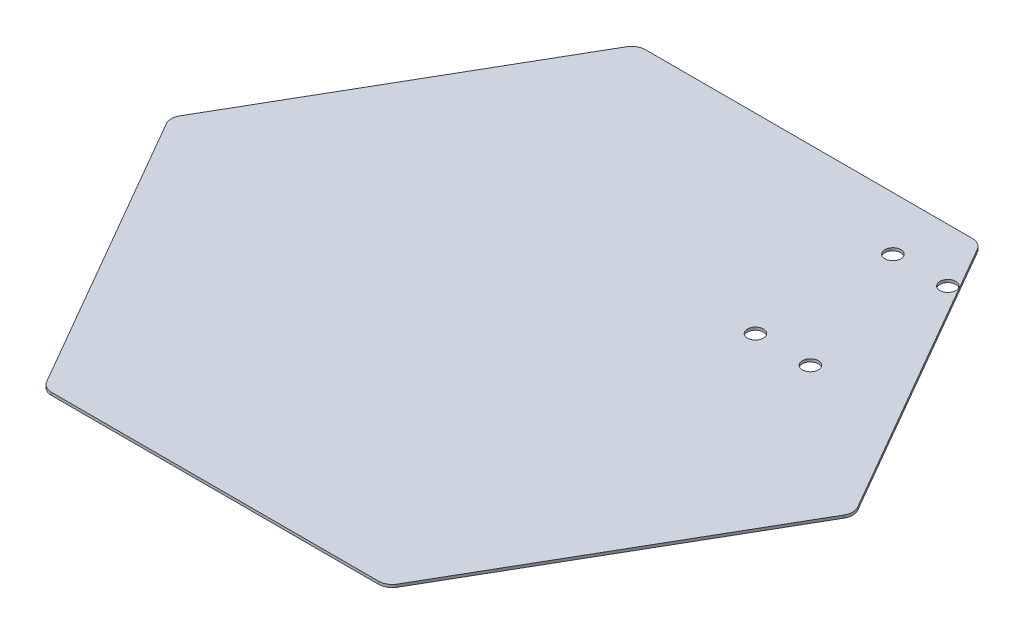
from build123d import *

# Parameters (mm, degrees)
BOSS_EXTRUDE1_DEPTH      = 1
FILLET1_R                = 5
M5_CLEARANCE_HOLE1_D     = 5.8
M5_CLEARANCE_HOLE1_DEPTH = 5
M5_CLEARANCE_HOLE1_TIP   = 1.742495795


with BuildPart() as part:
    # Sketch1 → Boss-Extrude1 (new body)
    with BuildSketch(Plane(origin=(0, 0, 0), x_dir=(1, 0, 0), z_dir=(0, 1, 0))):
        Polygon((62.353829072, 0), (187.061487217, 0), (249.41531629, 108), (187.061487217, 216), (62.353829072, 216), (0, 108), align=None)
    extrude(amount=BOSS_EXTRUDE1_DEPTH)

    # Fillet1
    fillet1_edges = [part.edges().sort_by_distance(p)[0] for p in [
        (0, 0.5, -108),
        (62.353829072, 0.5, -216),
        (187.061487217, 0.5, -216),
        (249.41531629, 0.5, -108),
        (62.353829072, 0.5, 0),
        (187.061487217, 0.5, 0),
    ]]
    fillet(fillet1_edges, radius=FILLET1_R)

    # M5 Clearance Hole1
    with Locations(Plane(origin=(0, 1, 0), x_dir=(1, 0, 0), z_dir=(0, 1, 0))):
        with Locations((174.707658145, 146.57), (194.707658145, 146.57), (194.707658145, 196.57), (174.707658145, 196.57)):
            Hole(M5_CLEARANCE_HOLE1_D / 2, depth=M5_CLEARANCE_HOLE1_DEPTH)
            with Locations((0, 0, -(M5_CLEARANCE_HOLE1_DEPTH + M5_CLEARANCE_HOLE1_TIP / 2))):  # 118° drill point
                Cone(0, M5_CLEARANCE_HOLE1_D / 2, M5_CLEARANCE_HOLE1_TIP, mode=Mode.SUBTRACT)


solid = part.part
